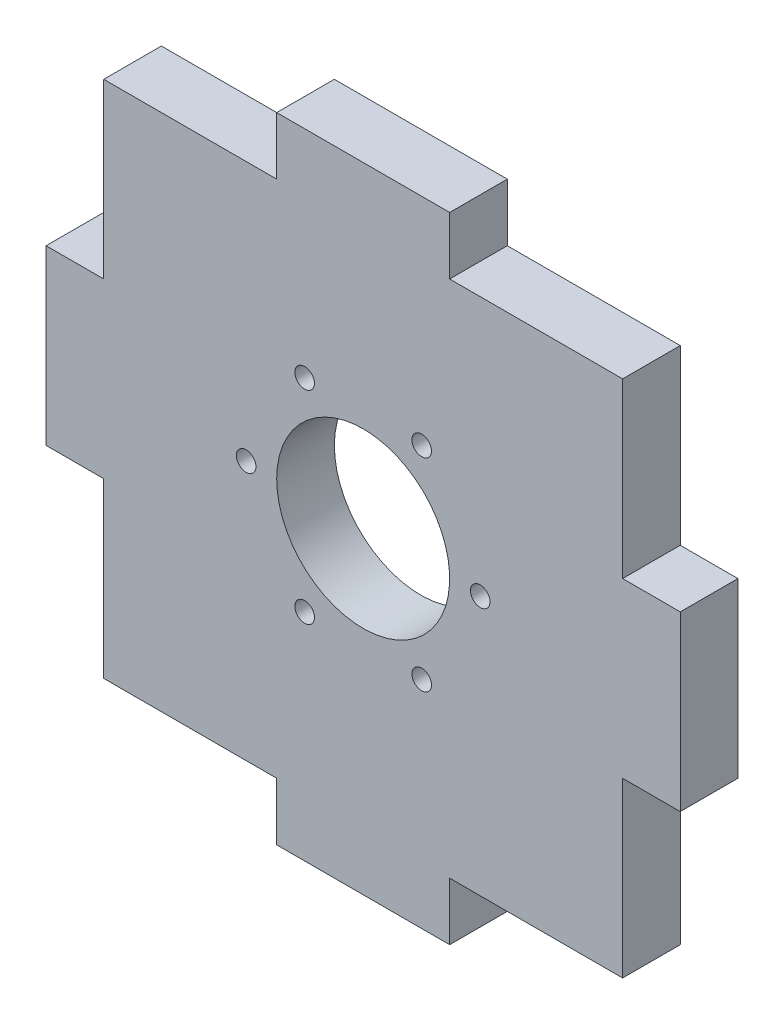
from build123d import *

# Parameters (mm, degrees)
BOSS_EXTRUDE1_DEPTH = 5
CAVITY1_OUTLINE_R   = 0.85
CAVITY1_OUTLINE_R_2 = 7.5
CAVITY1_DEPTH       = 5


# Read off the part's stored shape, not the designer's step: Cavity1
with BuildPart() as part:
    # Sketch1 → Boss-Extrude1 (new body)
    with BuildSketch(Plane.XY):
        Polygon((-25.25, 7.5), (-25.25, 22.5), (-10.25, 22.5), (-10.25, 27.5), (4.75, 27.5), (4.75, 22.5), (19.75, 22.5), (19.75, 7.5), (24.75, 7.5), (24.75, -7.5), (19.75, -7.5), (19.75, -22.5), (4.75, -22.5), (4.75, -27.5), (-10.25, -27.5), (-10.25, -22.5), (-25.25, -22.5), (-25.25, -7.5), (-30.25, -7.5), (-30.25, 7.5), align=None)
    extrude(amount=BOSS_EXTRUDE1_DEPTH)

    # Cavity1 outline → Cavity1 (cut)
    with BuildSketch(Plane.XY):
        with Locations((2.325, 8.790157848)):
            Circle(CAVITY1_OUTLINE_R)
        with Locations((-7.825, 8.790157848)):
            Circle(CAVITY1_OUTLINE_R)
        with Locations((-12.9, 0)):
            Circle(CAVITY1_OUTLINE_R)
        with Locations((-7.825, -8.790157848)):
            Circle(CAVITY1_OUTLINE_R)
        with Locations((2.325, -8.790157848)):
            Circle(CAVITY1_OUTLINE_R)
        with Locations((7.4, 0)):
            Circle(CAVITY1_OUTLINE_R)
        with Locations((-2.75, 0)):
            Circle(CAVITY1_OUTLINE_R_2)
    extrude(amount=CAVITY1_DEPTH, mode=Mode.SUBTRACT)


solid = part.part
